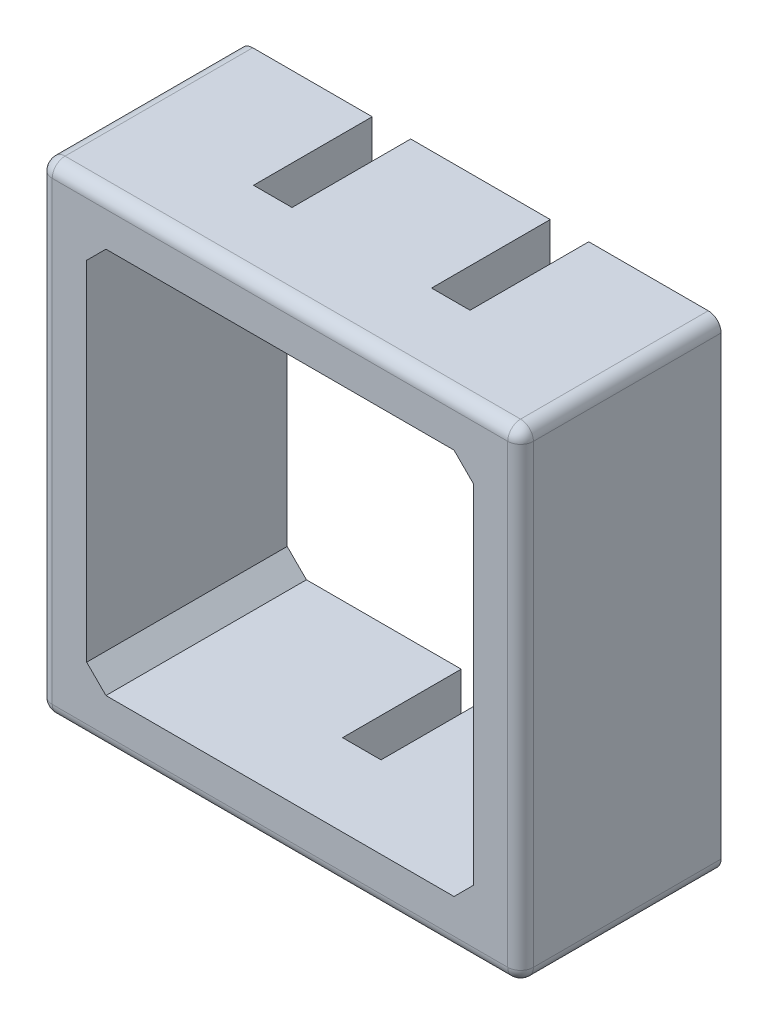
from build123d import *

# Parameters (mm, degrees)
SKETCH1_W                 = 19.05
SKETCH1_H                 = 19.05
SKETCH1_W_2               = 15.3035
SKETCH1_H_2               = 15.3035
BOSS_EXTRUDE1_DEPTH       = 7.9375
SKETCH2_W                 = 1.524
SKETCH2_H                 = 1.87325
CUT_EXTRUDE_THIN1_DEPTH   = 4.699
FILLET2_R                 = 0.508
CHAMFER1_SIZE             = 0.762
F_0_80_TAPPED_HOLE1_D     = 1.19126
F_0_80_TAPPED_HOLE1_DEPTH = 6.35
F_0_80_TAPPED_HOLE1_TIP   = 0.357890611


with BuildPart() as part:
    # Sketch1 → Boss-Extrude1 (new body)
    with BuildSketch(Plane.XY):
        with Locations((12.7, -106.3625)):
            Rectangle(SKETCH1_W, SKETCH1_H)
        with Locations((12.7, -106.3625)):
            Rectangle(SKETCH1_W_2, SKETCH1_H_2, mode=Mode.SUBTRACT)
    extrude(amount=-BOSS_EXTRUDE1_DEPTH)

    # Sketch2 → Cut-Extrude-Thin1 (cut)
    with BuildSketch(Plane(origin=(0, 0, -7.9375), x_dir=(-1, 0, 0), z_dir=(0, 0, -1))):
        with Locations((-12.7, -114.950875)):
            Rectangle(SKETCH2_W, SKETCH2_H)
        with Locations((-9.17575, -97.774125)):
            Rectangle(SKETCH2_W, SKETCH2_H)
        with Locations((-16.22425, -97.774125)):
            Rectangle(SKETCH2_W, SKETCH2_H)
    extrude(amount=-CUT_EXTRUDE_THIN1_DEPTH, mode=Mode.SUBTRACT)

    # Fillet2
    fillet2_edges = [part.edges().sort_by_distance(p)[0] for p in [
        (3.175, -115.8875, -3.96875),
        (22.225, -115.8875, -3.96875),
        (3.175, -96.8375, -3.96875),
        (22.225, -96.8375, -3.96875),
        (22.225, -106.3625, 0),
        (12.7, -115.8875, 0),
        (3.175, -106.3625, 0),
        (12.7, -96.8375, 0),
    ]]
    fillet(fillet2_edges, radius=FILLET2_R)

    # Chamfer1
    chamfer1_edges = [part.edges().sort_by_distance(p)[0] for p in [
        (20.35175, -98.71075, -3.96875),
        (5.04825, -98.71075, -3.96875),
        (5.04825, -114.01425, -3.96875),
        (20.35175, -114.01425, -3.96875),
    ]]
    chamfer(chamfer1_edges, length=CHAMFER1_SIZE)

    # #0-80 Tapped Hole1
    with Locations(Plane(origin=(0, 0, -7.9375), x_dir=(-1, 0, 0), z_dir=(0, 0, -1))):
        with Locations((-4.376519878, -98.039019878), (-21.023480122, -114.685980122)):
            Hole(F_0_80_TAPPED_HOLE1_D / 2, depth=F_0_80_TAPPED_HOLE1_DEPTH)
            with Locations((0, 0, -(F_0_80_TAPPED_HOLE1_DEPTH + F_0_80_TAPPED_HOLE1_TIP / 2))):  # 118° drill point
                Cone(0, F_0_80_TAPPED_HOLE1_D / 2, F_0_80_TAPPED_HOLE1_TIP, mode=Mode.SUBTRACT)


solid = part.part
